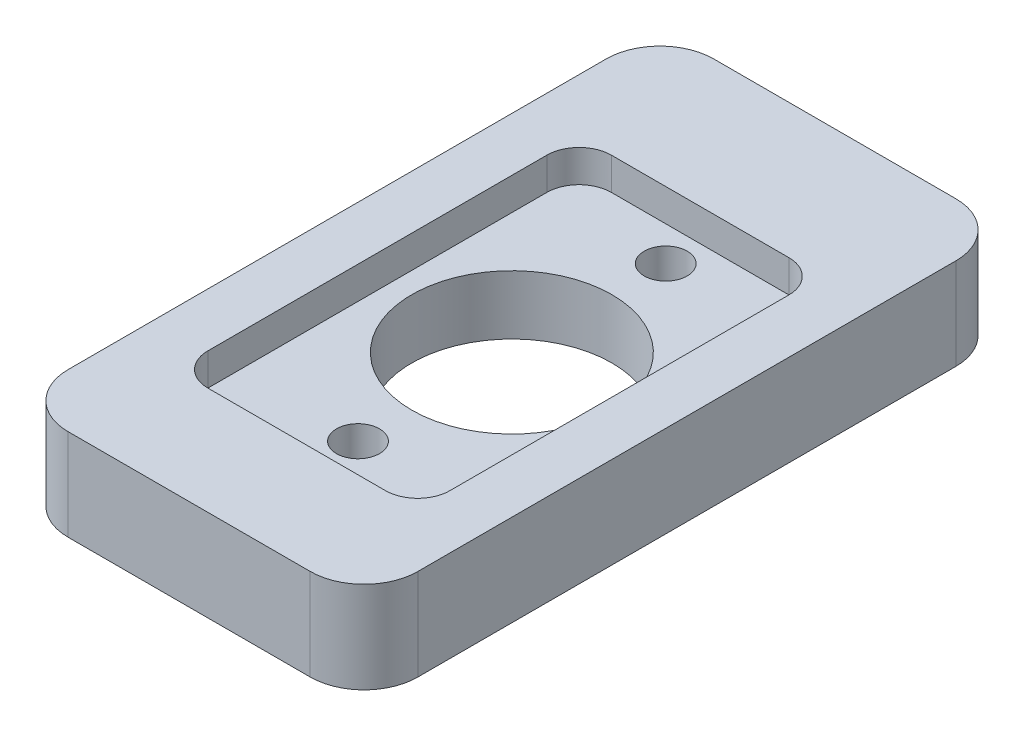
from build123d import *

# Parameters (mm, degrees)
BOSS_EXTRUDE1_DEPTH = 3.4
CUT_EXTRUDE1_DEPTH  = 1.2
SKETCH3_R           = 3.72
SKETCH3_R_2         = 0.8
CUT_EXTRUDE2_DEPTH  = 28.383206532


with BuildPart() as part:
    # Sketch1 → Boss-Extrude1 (new body)
    with BuildSketch(Plane(origin=(0, 0, 0), x_dir=(1, 0, 0), z_dir=(0, 1, 0))):
        with BuildLine():
            Line((2, 0), (11, 0))
            ThreePointArc((11, 0), (12.414213562, -0.585786438), (13, -2))
            Line((13, -2), (13, -22))
            ThreePointArc((13, -22), (12.414213562, -23.414213562), (11, -24))
            Line((11, -24), (2, -24))
            ThreePointArc((2, -24), (0.585786438, -23.414213562), (0, -22))
            Line((0, -22), (0, -2))
            ThreePointArc((0, -2), (0.585786438, -0.585786438), (2, 0))
        make_face()
    extrude(amount=BOSS_EXTRUDE1_DEPTH)

    # Sketch2 → Cut-Extrude1 (cut)
    with BuildSketch(Plane(origin=(0, 3.4, 0), x_dir=(1, 0, 0), z_dir=(0, 1, 0))):
        with BuildLine():
            Line((3.194715334, -5), (9.794715334, -5))
            ThreePointArc((9.794715334, -5), (10.643243471, -5.351471863), (10.994715334, -6.2))
            Line((10.994715334, -6.2), (10.994715334, -18.8))
            ThreePointArc((10.994715334, -18.8), (10.643243471, -19.648528137), (9.794715334, -20))
            Line((9.794715334, -20), (3.194715334, -20))
            ThreePointArc((3.194715334, -20), (2.346187196, -19.648528137), (1.994715334, -18.8))
            Line((1.994715334, -18.8), (1.994715334, -6.2))
            ThreePointArc((1.994715334, -6.2), (2.346187196, -5.351471863), (3.194715334, -5))
        make_face()
    extrude(amount=-CUT_EXTRUDE1_DEPTH, mode=Mode.SUBTRACT)

    # Sketch3 → Cut-Extrude2 (cut, through all)
    with BuildSketch(Plane(origin=(0, 2.2, 0), x_dir=(1, 0, 0), z_dir=(0, 1, 0))):
        with Locations((6.494715334, -12)):
            Circle(SKETCH3_R)
        with Locations((6.494715334, -6.28)):
            Circle(SKETCH3_R_2)
        with Locations((6.494715334, -17.72)):
            Circle(SKETCH3_R_2)
    extrude(amount=-CUT_EXTRUDE2_DEPTH, mode=Mode.SUBTRACT)


solid = part.part
